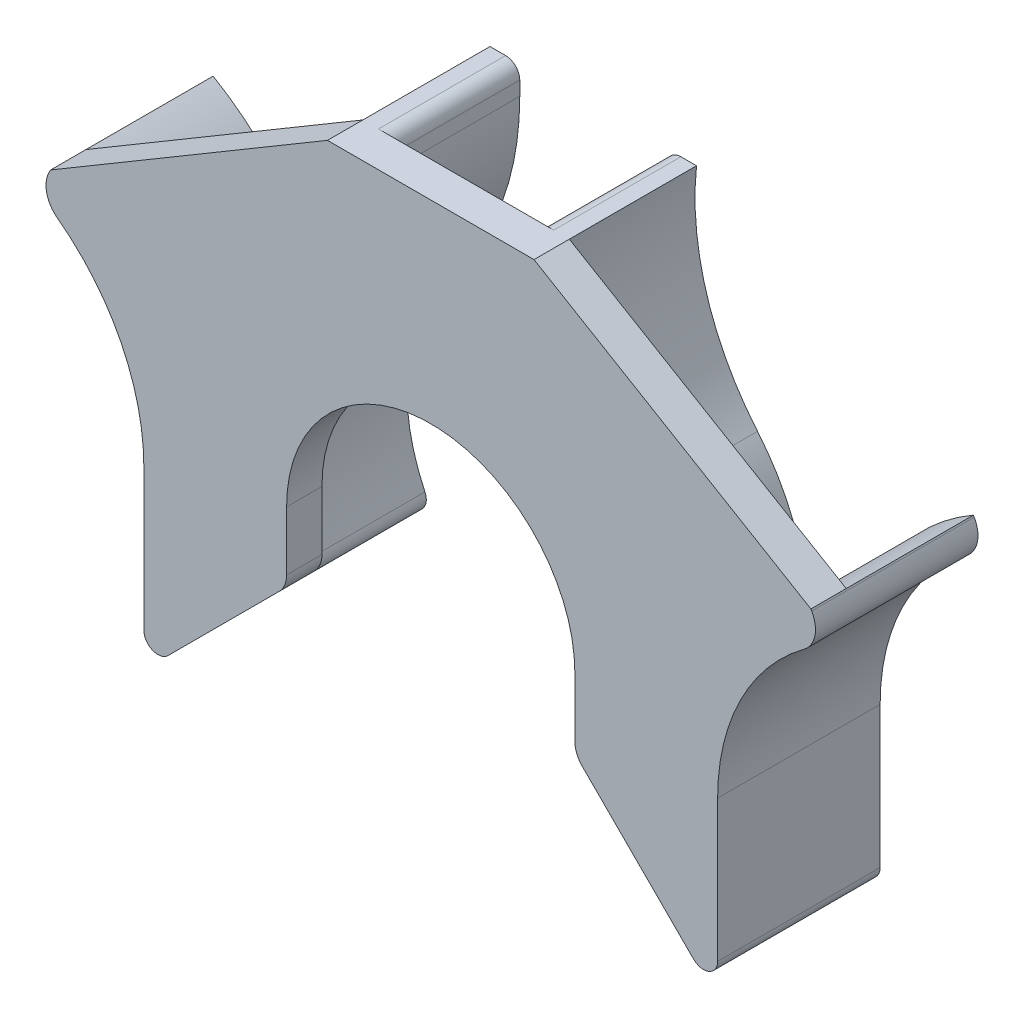
from build123d import *

# Parameters (mm, degrees)
EXTRUDE_THIN1_DEPTH = 9
BOSS_EXTRUDE1_START = 2.5
BOSS_EXTRUDE1_DEPTH = 2.5
SKETCH7_W           = 10.4
SKETCH7_H           = 2
CUT_EXTRUDE2_DEPTH  = 9
FILLET1_R           = 2
FILLET2_R           = 1
FILLET3_R           = 1


with BuildPart() as part:
    # Sketch4 → Extrude-Thin1 (new body)
    with BuildSketch(Plane.XY):
        with BuildLine():
            ThreePointArc((-27.9, 10.565509926), (-22.336413862, 5.001923789), (-20.3, -2.598076211))
            Line((-20.3, -2.598076211), (-20.3, -13))
            ThreePointArc((-20.3, -13), (-20.132058957, -13.759199288), (-19.659573823, -14.37673111))
            Line((-19.659573823, -14.37673111), (-11.593677676, -6.310834964))
            ThreePointArc((-11.593677676, -6.310834964), (-13.132911027, 1.329153101), (-10.094117647, 8.505809128))
            ThreePointArc((-10.094117647, 8.505809128), (-6.461802118, 14.774561158), (-5.2, 21.9089023))
            Line((-5.2, 21.9089023), (5.2, 21.9089023))
            ThreePointArc((5.2, 21.9089023), (6.461802118, 14.774561158), (10.094117647, 8.505809128))
            ThreePointArc((10.094117647, 8.505809128), (13.132911027, 1.329153101), (11.593677676, -6.310834964))
            Line((11.593677676, -6.310834964), (19.659573823, -14.37673111))
            ThreePointArc((19.659573823, -14.37673111), (20.132058957, -13.759199288), (20.3, -13))
            Line((20.3, -13), (20.3, -2.598076211))
            ThreePointArc((20.3, -2.598076211), (22.336413862, 5.001923789), (27.9, 10.565509926))
            Line((27.9, 10.565509926), (26.9, 12.297560734))
            ThreePointArc((26.9, 12.297560734), (20.604363055, 6.001923789), (18.3, -2.598076211))
            Line((18.3, -2.598076211), (18.3, -10.188730163))
            Line((18.3, -10.188730163), (14.009117998, -5.897848161))
            ThreePointArc((14.009117998, -5.897848161), (15.027346247, 2.28448348), (11.623529412, 9.794568087))
            ThreePointArc((11.623529412, 9.794568087), (8.022061411, 16.410382128), (7.306685687, 23.9089023))
            Line((7.306685687, 23.9089023), (-7.306685687, 23.9089023))
            ThreePointArc((-7.306685687, 23.9089023), (-8.022061411, 16.410382128), (-11.623529412, 9.794568087))
            ThreePointArc((-11.623529412, 9.794568087), (-15.027346247, 2.28448348), (-14.009117998, -5.897848161))
            Line((-14.009117998, -5.897848161), (-18.3, -10.188730163))
            Line((-18.3, -10.188730163), (-18.3, -2.598076211))
            ThreePointArc((-18.3, -2.598076211), (-20.604363055, 6.001923789), (-26.9, 12.297560734))
            Line((-26.9, 12.297560734), (-27.9, 10.565509926))
        make_face()
    extrude(amount=-EXTRUDE_THIN1_DEPTH)

    # Sketch5 → Boss-Extrude1 (add)
    with BuildSketch(Plane.XY.offset(BOSS_EXTRUDE1_START)):
        with BuildLine():
            Line((-26.9, 12.297560734), (-7.306685687, 23.9089023))
            ThreePointArc((-7.306685687, 23.9089023), (-8.022061411, 16.410382128), (-11.623529412, 9.794568087))
            ThreePointArc((-11.623529412, 9.794568087), (-15.027346247, 2.28448348), (-14.009117998, -5.897848161))
            Line((-14.009117998, -5.897848161), (-18.3, -10.188730163))
            Line((-18.3, -10.188730163), (-18.3, -2.598076211))
            ThreePointArc((-18.3, -2.598076211), (-20.604363055, 6.001923789), (-26.9, 12.297560734))
        make_face()
        with BuildLine():
            ThreePointArc((-18.3, -2.598076211), (-20.604363055, 6.001923789), (-26.9, 12.297560734))
            Line((-26.9, 12.297560734), (-27.9, 10.565509926))
            ThreePointArc((-27.9, 10.565509926), (-22.336413862, 5.001923789), (-20.3, -2.598076211))
            Line((-20.3, -2.598076211), (-20.3, -13))
            ThreePointArc((-20.3, -13), (-20.132058957, -13.759199288), (-19.659573823, -14.37673111))
            Line((-19.659573823, -14.37673111), (-19.555634919, -14.272792206))
            Line((-19.555634919, -14.272792206), (-11.593677676, -6.310834964))
            ThreePointArc((-11.593677676, -6.310834964), (-13.132911027, 1.329153101), (-10.094117647, 8.505809128))
            ThreePointArc((-10.094117647, 8.505809128), (-6.461802118, 14.774561158), (-5.2, 21.9089023))
            Line((-5.2, 21.9089023), (5.2, 21.9089023))
            ThreePointArc((5.2, 21.9089023), (6.461802118, 14.774561158), (10.094117647, 8.505809128))
            ThreePointArc((10.094117647, 8.505809128), (13.132911027, 1.329153101), (11.593677676, -6.310834964))
            Line((11.593677676, -6.310834964), (19.555634919, -14.272792206))
            Line((19.555634919, -14.272792206), (19.659573823, -14.37673111))
            ThreePointArc((19.659573823, -14.37673111), (20.132058957, -13.759199288), (20.3, -13))
            Line((20.3, -13), (20.3, -2.598076211))
            ThreePointArc((20.3, -2.598076211), (22.336413862, 5.001923789), (27.9, 10.565509926))
            Line((27.9, 10.565509926), (26.9, 12.297560734))
            ThreePointArc((26.9, 12.297560734), (20.604363055, 6.001923789), (18.3, -2.598076211))
            Line((18.3, -2.598076211), (18.3, -10.188730163))
            Line((18.3, -10.188730163), (14.009117998, -5.897848161))
            ThreePointArc((14.009117998, -5.897848161), (15.027346247, 2.28448348), (11.623529412, 9.794568087))
            ThreePointArc((11.623529412, 9.794568087), (8.022061411, 16.410382128), (7.306685687, 23.9089023))
            Line((7.306685687, 23.9089023), (-7.306685687, 23.9089023))
            ThreePointArc((-7.306685687, 23.9089023), (-8.022061411, 16.410382128), (-11.623529412, 9.794568087))
            ThreePointArc((-11.623529412, 9.794568087), (-15.027346247, 2.28448348), (-14.009117998, -5.897848161))
            Line((-14.009117998, -5.897848161), (-18.3, -10.188730163))
            Line((-18.3, -10.188730163), (-18.3, -2.598076211))
        make_face()
        with BuildLine():
            Line((7.306685687, 23.9089023), (26.9, 12.297560734))
            ThreePointArc((26.9, 12.297560734), (20.604363055, 6.001923789), (18.3, -2.598076211))
            Line((18.3, -2.598076211), (18.3, -10.188730163))
            Line((18.3, -10.188730163), (14.009117998, -5.897848161))
            ThreePointArc((14.009117998, -5.897848161), (15.027346247, 2.28448348), (11.623529412, 9.794568087))
            ThreePointArc((11.623529412, 9.794568087), (8.022061411, 16.410382128), (7.306685687, 23.9089023))
        make_face()
        with BuildLine():
            ThreePointArc((-10.094117647, 8.505809128), (-13.132911027, 1.329153101), (-11.593677676, -6.310834964))
            Line((-11.593677676, -6.310834964), (-10.727207794, -5.444365081))
            ThreePointArc((-10.727207794, -5.444365081), (-10.337016841, -4.860403054), (-10.2, -4.171572875))
            Line((-10.2, -4.171572875), (-10.2, 0))
            ThreePointArc((-10.2, 0), (0, 10.2), (10.2, 0))
            Line((10.2, 0), (10.2, -4.171572875))
            ThreePointArc((10.2, -4.171572875), (10.337016841, -4.860403054), (10.727207794, -5.444365081))
            Line((10.727207794, -5.444365081), (11.593677676, -6.310834964))
            ThreePointArc((11.593677676, -6.310834964), (13.132911027, 1.329153101), (10.094117647, 8.505809128))
            ThreePointArc((10.094117647, 8.505809128), (6.461802118, 14.774561158), (5.2, 21.9089023))
            Line((5.2, 21.9089023), (-5.2, 21.9089023))
            ThreePointArc((-5.2, 21.9089023), (-6.461802118, 14.774561158), (-10.094117647, 8.505809128))
        make_face()
    extrude(amount=-BOSS_EXTRUDE1_DEPTH)

    # Sketch7 → Cut-Extrude2 (cut)
    with BuildSketch(Plane.XY.offset(-9)):
        with Locations((0, 22.9089023)):
            Rectangle(SKETCH7_W, SKETCH7_H)
    extrude(amount=CUT_EXTRUDE2_DEPTH, mode=Mode.SUBTRACT)

    # Fillet1
    fillet1_edges = [part.edges().sort_by_distance(p)[0] for p in [
        (27.9, 10.565509926, -3.25),
        (-27.9, 10.565509926, -3.25),
    ]]
    fillet(fillet1_edges, radius=FILLET1_R)

    # Fillet2
    # the kernel refuses this fillet: 1 mm, written as the material it takes off along each edge
    with BuildSketch(Plane(origin=(19.659573823, -14.37673111, -13.714649626), x_dir=(0.33959372810271005, 0.9405722193608009, 0), z_dir=(0, 0, 1))) as fillet2_piece_1:
        with BuildLine():
            CenterArc((1.546266122, 0.940572219), FILLET2_R, 154.852123731, 135)
            Line((0.6410521, 1.365528186), (0.550530698, 1.408023783))
            Line((0.550530698, 1.408023783), (-0.090521402, 0.042495597))
            Line((-0.090521402, 0.042495597), (-0.050062835, -0.086566232))
            ThreePointArc((-0.050062835, -0.086566232), (1.546359122, -0.228895043), (1.919819223, -0.094057222))
            Line((1.919819223, -0.094057222), (1.885859851, 0))
        make_face()
    extrude(amount=20.929299253, mode=Mode.SUBTRACT)
    with BuildSketch(Plane(origin=(-19.659573823, -14.37673111, -13.714649626), x_dir=(-0.3395937281027359, 0.9405722193607915, 0), z_dir=(0, 0, 1))) as fillet2_piece_2:
        with BuildLine():
            CenterArc((1.546266122, -0.940572219), FILLET2_R, 70.147876269, 135)
            Line((0.6410521, -1.365528186), (0.550530698, -1.408023783))
            Line((0.550530698, -1.408023783), (-0.090521402, -0.042495597))
            Line((-0.090521402, -0.042495597), (-0.050062835, 0.086566232))
            ThreePointArc((-0.050062835, 0.086566232), (1.546359122, 0.228895043), (1.919819223, 0.094057222))
            Line((1.919819223, 0.094057222), (1.885859851, 0))
        make_face()
    extrude(amount=20.929299253, mode=Mode.SUBTRACT)

    # Fillet3
    fillet3_edges = [part.edges().sort_by_distance(p)[0] for p in [
        (-5.2, 23.9089023, -4.5),
        (5.2, 23.9089023, -4.5),
        (-18.3, -10.188730163, -4.5),
        (-14.009117998, -5.897848161, -4.5),
        (14.009117998, -5.897848161, -4.5),
        (18.3, -10.188730163, -4.5),
        (11.593677676, -6.310834964, -4.5),
        (-11.593677676, -6.310834964, -4.5),
    ]]
    fillet(fillet3_edges, radius=FILLET3_R)


solid = part.part
